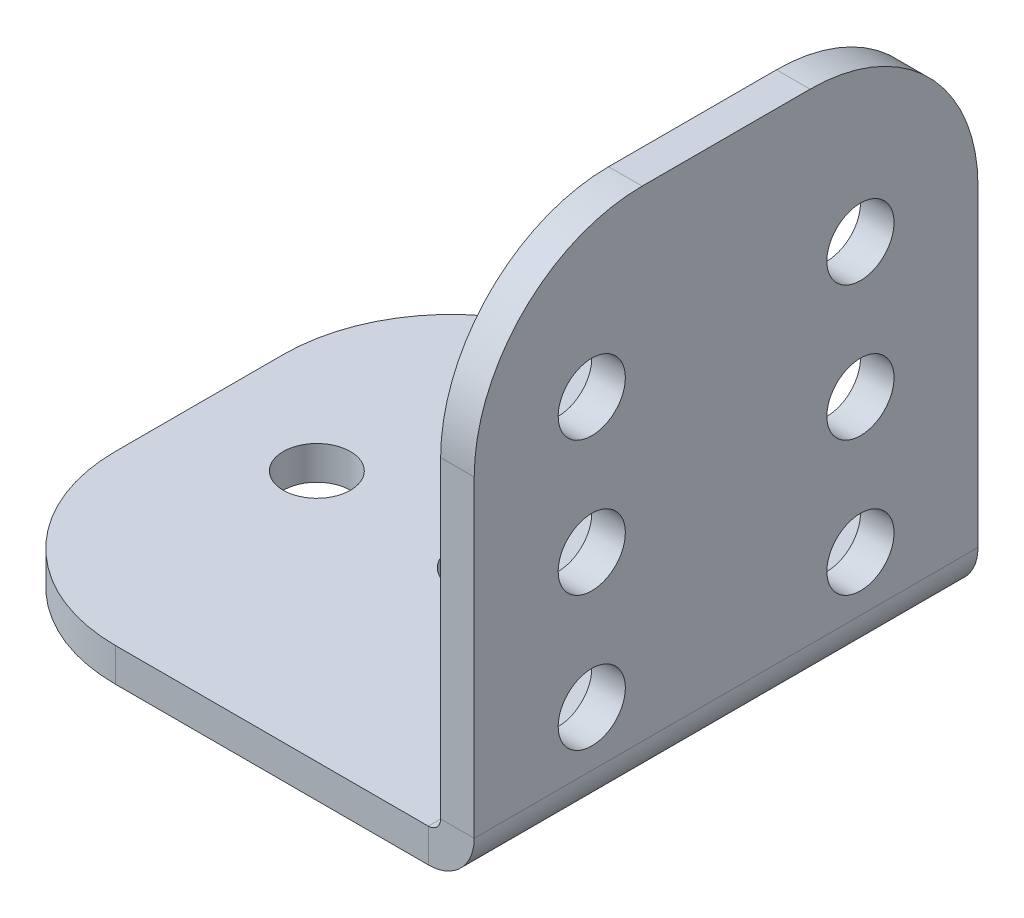
from build123d import *

# Parameters (mm, degrees)
BASE_FLANGE1_DEPTH       = 2
SKETCHED_START           = 1.372677549
SKETCHED_BEND1_OUTLINE_W = 2
SKETCHED_BEND1_OUTLINE_H = 30
SKETCHED_BEND1_DEPTH     = 28.627322451
SKETCHED_START_2         = -0.627322451
SKETCHED_BEND1_2_DEPTH   = 1.733838284
SKETCHED_START_3         = -1.363922451
SKETCHED_BEND1_3_DEPTH   = 2.7366
SKETCHED_START_4         = -15
SKETCHED_BEND1_4_DEPTH   = 30
SKETCH8_R                = 2
CUT_EXTRUDE1_DEPTH       = 10
SKETCH9_R                = 2
CUT_EXTRUDE2_DEPTH       = 10


with BuildPart() as part:
    # Base-Flange1: sheet metal written as solids
    # Sketch1 → Base-Flange1 (new body)
    with BuildSketch(Plane(origin=(0, 0, 0), x_dir=(1, 0, 0), z_dir=(0, 1, 0))):
        with BuildLine():
            Line((-20, -15), (20, -15))
            ThreePointArc((20, -15), (27.071067812, -12.071067812), (30, -5))
            Line((30, -5), (30, 5))
            ThreePointArc((30, 5), (27.071067812, 12.071067812), (20, 15))
            Line((20, 15), (-20, 15))
            ThreePointArc((-20, 15), (-27.071067812, 12.071067812), (-30, 5))
            Line((-30, 5), (-30, -5))
            ThreePointArc((-30, -5), (-27.071067812, -12.071067812), (-20, -15))
        make_face()
    extrude(amount=-BASE_FLANGE1_DEPTH)

    # Sketched Bend1: read off the stored shape, not the designer's step
    # Sketched Bend1 outline → Sketched Bend1 (cut)
    with BuildSketch(Plane.YZ.offset(SKETCHED_START)):
        with Locations((-1, 0)):
            Rectangle(SKETCHED_BEND1_OUTLINE_W, SKETCHED_BEND1_OUTLINE_H)
    extrude(amount=SKETCHED_BEND1_DEPTH, mode=Mode.SUBTRACT)

    # Sketched Bend1 2 outline → Sketched Bend1 2 (add)
    with BuildSketch(Plane.YZ.offset(SKETCHED_START_2)):
        with BuildLine():
            ThreePointArc((29.372677549, 5), (26.443745361, 12.071067812), (19.372677549, 15))
            Line((19.372677549, 15), (0, 15))
            Line((0, 15), (0, -15))
            Line((0, -15), (19.372677549, -15))
            ThreePointArc((19.372677549, -15), (26.443745361, -12.071067812), (29.372677549, -5))
            Line((29.372677549, -5), (29.372677549, 5))
        make_face()
    extrude(amount=SKETCHED_BEND1_2_DEPTH)

    # Sketched Bend1 3 outline → Sketched Bend1 3 (add)
    with BuildSketch(Plane.YZ.offset(SKETCHED_START_3)):
        with BuildLine():
            ThreePointArc((29.372677549, 5), (26.443745361, 12.071067812), (19.372677549, 15))
            Line((19.372677549, 15), (0, 15))
            Line((0, 15), (0, -15))
            Line((0, -15), (19.372677549, -15))
            ThreePointArc((19.372677549, -15), (26.443745361, -12.071067812), (29.372677549, -5))
            Line((29.372677549, -5), (29.372677549, 5))
        make_face()
    extrude(amount=SKETCHED_BEND1_3_DEPTH)

    # Sketched Bend1 4 outline → Sketched Bend1 4 (cut)
    with BuildSketch(Plane.XY.offset(SKETCHED_START_4)):
        with BuildLine():
            Line((-0.627322451, 0.7366), (-0.627322451, 29.372677549))
            Line((-0.627322451, 29.372677549), (-1.363922451, 29.372677549))
            Line((-1.363922451, 29.372677549), (-1.363922451, 0))
            ThreePointArc((-1.363922451, 0), (-0.843067596, 0.215745145), (-0.627322451, 0.7366))
        make_face()
        with BuildLine():
            Line((1.372677549, -2), (1.372677549, 0.7366))
            ThreePointArc((1.372677549, 0.7366), (0.571145967, -1.198468417), (-1.363922451, -2))
            Line((-1.363922451, -2), (1.372677549, -2))
        make_face()
    extrude(amount=SKETCHED_BEND1_4_DEPTH, mode=Mode.SUBTRACT)

    # Sketch8 → Cut-Extrude1 (cut)
    with BuildSketch(Plane.ZY.offset(0.627322451)):
        with Locations(Location((-8, 4, 0), (0, 0, 270))):
            Circle(SKETCH8_R)
        with Locations(Location((8, 4, 0), (0, 0, 270))):
            Circle(SKETCH8_R)
        with Locations(Location((-8, 12, 0), (0, 0, 270))):
            Circle(SKETCH8_R)
        with Locations(Location((-8, 20, 0), (0, 0, 270))):
            Circle(SKETCH8_R)
        with Locations(Location((8, 20, 0), (0, 0, 270))):
            Circle(SKETCH8_R)
        with Locations(Location((8, 12, 0), (0, 0, 270))):
            Circle(SKETCH8_R)
    extrude(amount=-CUT_EXTRUDE1_DEPTH, mode=Mode.SUBTRACT)

    # Sketch9 → Cut-Extrude2 (cut)
    with BuildSketch(Plane(origin=(0, 0, 0), x_dir=(1, 0, 0), z_dir=(0, 1, 0))):
        with Locations(Location((-23, 0, 0), (0, 0, 270))):
            Circle(SKETCH9_R)
        with Locations(Location((-13, 0, 0), (0, 0, 270))):
            Circle(SKETCH9_R)
    extrude(amount=-CUT_EXTRUDE2_DEPTH, mode=Mode.SUBTRACT)


solid = part.part
